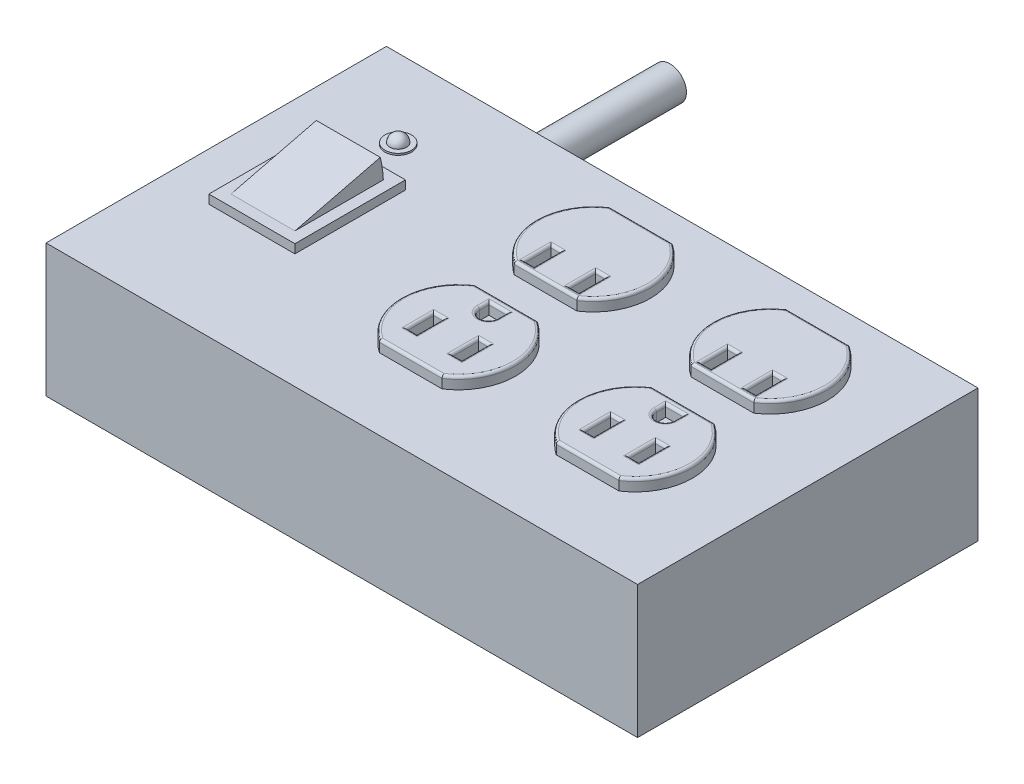
from build123d import *

# Parameters (mm, degrees)
SKETCH1_W               = 169.926
SKETCH1_H               = 97.79
EXTRUDE1_DEPTH          = 38.1
SKETCH2_W               = 24.7142
SKETCH2_H               = 31.75
EXTRUDE2_DEPTH          = 2.54
SKETCH3_W               = 18.3642
SKETCH3_H               = 25.4
CUT_EXTRUDE1_DEPTH      = 2.54
EXTRUDE3_DEPTH          = 18.3642
SKETCH5_R               = 3.81
EXTRUDE4_DEPTH          = 0.508
EXTRUDE6_DEPTH          = 3.3528
SKETCH9_W               = 2.8448
SKETCH9_H               = 7.62
CUT_EXTRUDE2_DEPTH      = 3.3528
FILLET10_R              = 0.762
LPATTERN2_COUNT         = 2
LPATTERN2_PITCH         = 50.8
FILLET10_OF_LPATTERN2_R = 0.762
SKETCH10_R              = 11.1125
EXTRUDE7_DEPTH          = 7.9248
FILLET11_R              = 3.175
SKETCH11_R              = 4.7625
EXTRUDE8_DEPTH          = 42.756866563
CUT_EXTRUDE3_DEPTH      = 1.524
SHELL1_START            = 0.762
SHELL1_OUTLINE_W        = 168.402
SHELL1_OUTLINE_H        = 96.266
SHELL1_DEPTH            = 36.576
SHELL1_START_2          = 1.524
SHELL1_2_OUTLINE_W      = 4.3688
SHELL1_2_OUTLINE_H      = 9.144
SHELL1_2_DEPTH          = 39.1668
SHELL1_3_DEPTH          = 35.814
SHELL1_START_3          = 37.338
SHELL1_4_OUTLINE_W      = 23.1902
SHELL1_4_OUTLINE_H      = 30.226
SHELL1_4_OUTLINE_W_2    = 19.8882
SHELL1_4_OUTLINE_H_2    = 26.924
SHELL1_4_DEPTH          = 2.54
SHELL1_5_OUTLINE_R      = 3.048
SHELL1_5_DEPTH          = 0.508
LPATTERN3_COUNT         = 2
LPATTERN3_PITCH         = 273.05
LPATTERN3_COUNT_DIR2    = 2
LPATTERN3_PITCH_DIR2    = 69.85


with BuildPart() as part:
    # Sketch1 → Extrude1 (new body)
    with BuildSketch(Plane(origin=(0, 0, 0), x_dir=(1, 0, 0), z_dir=(0, 1, 0))):
        Rectangle(SKETCH1_W, SKETCH1_H)
    extrude(amount=EXTRUDE1_DEPTH)

    # Sketch2 → Extrude2 (add)
    with BuildSketch(Plane(origin=(0, 38.1, 0), x_dir=(-1, 0, 0), z_dir=(0, 1, 0))):
        with Locations((58.8391, 0)):
            Rectangle(SKETCH2_W, SKETCH2_H)
    extrude(amount=EXTRUDE2_DEPTH)

    # Sketch3 → Cut-Extrude1 (cut)
    with BuildSketch(Plane(origin=(0, 40.64, 0), x_dir=(-1, 0, 0), z_dir=(0, 1, 0))):
        with Locations((58.8391, 0)):
            Rectangle(SKETCH3_W, SKETCH3_H)
    extrude(amount=-CUT_EXTRUDE1_DEPTH, mode=Mode.SUBTRACT)

    # Sketch5 → Extrude4 (add)
    with BuildSketch(Plane(origin=(0, 38.1, 0), x_dir=(-1, 0, 0), z_dir=(0, 1, 0))):
        with Locations(Location((58.8391, -26.162, 0), (0, 0, 90))):
            Circle(SKETCH5_R)
    extrude(amount=EXTRUDE4_DEPTH)

    # Sketch6 → Revolve2 (revolve)
    with BuildSketch(Plane(origin=(-3.381296693, 0, 5.856577668), x_dir=(-0.8660254037844382, 0, -0.5000000000000009), z_dir=(0.5000000000000009, 0, -0.8660254037844382))):
        with BuildLine():
            Line((64.037155336, 38.608), (64.037155336, 40.9829))
            ThreePointArc((64.037155336, 40.9829), (61.662255336, 38.608), (64.037155336, 36.2331))
            Line((64.037155336, 36.2331), (64.037155336, 38.608))
        make_face()
    revolve(axis=Axis((-58.8391, 38.608, -26.162), (0, -1, 0)))

    # Sketch8 → Extrude6 (add)
    with BuildSketch(Plane(origin=(0, 38.1, 0), x_dir=(-1, 0, 0), z_dir=(0, 1, 0))):
        with BuildLine():
            Line((-59.043938849, 28.321), (-41.032061151, 28.321))
            ThreePointArc((-41.032061151, 28.321), (-33.6296, 14.605), (-41.032061151, 0.889))
            Line((-41.032061151, 0.889), (-59.043938849, 0.889))
            ThreePointArc((-59.043938849, 0.889), (-66.4464, 14.605), (-59.043938849, 28.321))
        make_face()
        with BuildLine():
            Line((-59.043938849, -10.414), (-41.032061151, -10.414))
            ThreePointArc((-41.032061151, -10.414), (-33.6296, -24.13), (-41.032061151, -37.846))
            Line((-41.032061151, -37.846), (-59.043938849, -37.846))
            ThreePointArc((-59.043938849, -37.846), (-66.4464, -24.13), (-59.043938849, -10.414))
        make_face()
    extrude6 = extrude(amount=EXTRUDE6_DEPTH)

    # Sketch9 → Cut-Extrude2 (cut)
    with BuildSketch(Plane(origin=(0, 41.4528, 0), x_dir=(-1, 0, 0), z_dir=(0, 1, 0))):
        with Locations((-56.4896, 17.6784)):
            Rectangle(SKETCH9_W, SKETCH9_H)
        with Locations((-43.5864, 17.6784)):
            Rectangle(SKETCH9_W, SKETCH9_H)
        with BuildLine():
            Line((-52.6415, 3.2766), (-47.4345, 3.2766))
            Line((-47.4345, 3.2766), (-47.4345, 5.9309))
            ThreePointArc((-47.4345, 5.9309), (-50.038, 8.5344), (-52.6415, 5.9309))
            Line((-52.6415, 5.9309), (-52.6415, 3.2766))
        make_face()
        with Locations((-56.4896, -15.9766)):
            Rectangle(SKETCH9_W, SKETCH9_H)
        with Locations((-43.5864, -15.9766)):
            Rectangle(SKETCH9_W, SKETCH9_H)
        with BuildLine():
            Line((-124.841, -30.3784), (-119.634, -30.3784))
            Line((-119.634, -30.3784), (-119.634, -27.7241))
            ThreePointArc((-119.634, -27.7241), (-122.2375, -25.1206), (-124.841, -27.7241))
            Line((-124.841, -27.7241), (-124.841, -30.3784))
        make_face()
    cut_extrude2 = extrude(amount=-CUT_EXTRUDE2_DEPTH, mode=Mode.SUBTRACT)

    # Fillet10
    fillet10_edges = [part.edges().sort_by_distance(p)[0] for p in [
        (57.912, 41.4528, -15.9766),
        (56.4896, 41.4528, -19.7866),
        (55.0672, 41.4528, -15.9766),
        (56.4896, 41.4528, -12.1666),
        (45.0088, 41.4528, -15.9766),
        (43.5864, 41.4528, -19.7866),
        (42.164, 41.4528, -15.9766),
        (43.5864, 41.4528, -12.1666),
        (33.6296, 41.4528, 14.605),
        (50.038, 41.4528, 28.321),
        (66.4464, 41.4528, 14.605),
        (50.038, 41.4528, 0.889),
        (33.6296, 41.4528, -24.13),
        (50.038, 41.4528, -10.414),
        (66.4464, 41.4528, -24.13),
        (50.038, 41.4528, -37.846),
        (57.912, 41.4528, 17.6784),
        (56.4896, 41.4528, 13.8684),
        (55.0672, 41.4528, 17.6784),
        (56.4896, 41.4528, 21.4884),
        (45.0088, 41.4528, 17.6784),
        (43.5864, 41.4528, 13.8684),
        (42.164, 41.4528, 17.6784),
        (43.5864, 41.4528, 21.4884),
        (52.6415, 41.4528, 4.60375),
        (50.038, 41.4528, 3.2766),
        (47.4345, 41.4528, 4.60375),
        (50.038, 41.4528, 8.5344),
    ]]
    fillet(fillet10_edges, radius=FILLET10_R)

    # LPattern2: Extrude6, Cut-Extrude2 ×2
    with Locations(*[(-i * LPATTERN2_PITCH, 0, 0) for i in range(1, LPATTERN2_COUNT)]):
        add(extrude6)
        add(cut_extrude2, mode=Mode.SUBTRACT)

    # Fillet10 of LPattern2
    fillet10_of_lpattern2_edges = [part.edges().sort_by_distance(p)[0] for p in [
        (7.112, 41.4528, -15.9766),
        (5.6896, 41.4528, -19.7866),
        (4.2672, 41.4528, -15.9766),
        (5.6896, 41.4528, -12.1666),
        (-5.7912, 41.4528, -15.9766),
        (-7.2136, 41.4528, -19.7866),
        (-8.636, 41.4528, -15.9766),
        (-7.2136, 41.4528, -12.1666),
        (-17.1704, 41.4528, 14.605),
        (-0.762, 41.4528, 28.321),
        (15.6464, 41.4528, 14.605),
        (-0.762, 41.4528, 0.889),
        (-17.1704, 41.4528, -24.13),
        (-0.762, 41.4528, -10.414),
        (15.6464, 41.4528, -24.13),
        (-0.762, 41.4528, -37.846),
        (7.112, 41.4528, 17.6784),
        (5.6896, 41.4528, 13.8684),
        (4.2672, 41.4528, 17.6784),
        (5.6896, 41.4528, 21.4884),
        (-5.7912, 41.4528, 17.6784),
        (-7.2136, 41.4528, 13.8684),
        (-8.636, 41.4528, 17.6784),
        (-7.2136, 41.4528, 21.4884),
        (1.8415, 41.4528, 4.60375),
        (-0.762, 41.4528, 3.2766),
        (-3.3655, 41.4528, 4.60375),
        (-0.762, 41.4528, 8.5344),
    ]]
    fillet(fillet10_of_lpattern2_edges, radius=FILLET10_OF_LPATTERN2_R)

    # Sketch10 → Extrude7 (add)
    with BuildSketch(Plane(origin=(0, 0, -48.895), x_dir=(-1, 0, 0), z_dir=(0, 0, -1))):
        with Locations(Location((54.229, 19.05, 0), (0, 0, 180))):
            Circle(SKETCH10_R)
    extrude(amount=EXTRUDE7_DEPTH)

    # Fillet11
    fillet11_edges = [part.edges().sort_by_distance(p)[0] for p in [
        (-65.3415, 19.05, -56.8198),
    ]]
    fillet(fillet11_edges, radius=FILLET11_R)

    # Sketch11 → Extrude8 (add)
    with BuildSketch(Plane(origin=(0, 0, -56.8198), x_dir=(-1, 0, 0), z_dir=(0, 0, -1))):
        with Locations((54.229, 19.05)):
            Circle(SKETCH11_R)
    extrude(amount=EXTRUDE8_DEPTH)

    # Sketch12 → Cut-Extrude3 (cut)
    with BuildSketch(Plane.XZ):
        with BuildLine():
            Line((54.707611376, 27.94), (58.238211376, 27.94))
            ThreePointArc((58.238211376, 27.94), (58.981216761, 26.926416761), (59.9948, 26.183411376))
            Line((59.9948, 26.183411376), (59.9948, 22.652811376))
            ThreePointArc((59.9948, 22.652811376), (61.8998, 20.747811376), (63.8048, 22.652811376))
            Line((63.8048, 22.652811376), (63.8048, 26.183411376))
            ThreePointArc((63.8048, 26.183411376), (64.818383239, 26.926416761), (65.561388624, 27.94))
            Line((65.561388624, 27.94), (69.091988624, 27.94))
            ThreePointArc((69.091988624, 27.94), (70.996988624, 29.845), (69.091988624, 31.75))
            Line((69.091988624, 31.75), (65.561388624, 31.75))
            ThreePointArc((65.561388624, 31.75), (64.818383239, 32.763583239), (63.8048, 33.506588624))
            Line((63.8048, 33.506588624), (63.8048, 37.037188624))
            ThreePointArc((63.8048, 37.037188624), (61.8998, 38.942188624), (59.9948, 37.037188624))
            Line((59.9948, 37.037188624), (59.9948, 33.506588624))
            ThreePointArc((59.9948, 33.506588624), (58.981216761, 32.763583239), (58.238211376, 31.75))
            Line((58.238211376, 31.75), (54.707611376, 31.75))
            ThreePointArc((54.707611376, 31.75), (52.802611376, 29.845), (54.707611376, 27.94))
        make_face()
    cut_extrude3 = extrude(amount=-CUT_EXTRUDE3_DEPTH, mode=Mode.SUBTRACT)

    # Shell1: read off the stored shape, not the designer's step
    # Shell1 outline → Shell1 (cut)
    with BuildSketch(Plane(origin=(0, 0, 0), x_dir=(1, 0, 0), z_dir=(0, 1, 0)).offset(SHELL1_START)):
        Rectangle(SHELL1_OUTLINE_W, SHELL1_OUTLINE_H)
        with BuildLine():
            ThreePointArc((54.707611376, -32.512), (52.040611376, -29.845), (54.707611376, -27.178))
            Line((54.707611376, -27.178), (57.801712489, -27.178))
            ThreePointArc((57.801712489, -27.178), (58.442401393, -26.387601393), (59.2328, -25.746912489))
            Line((59.2328, -25.746912489), (59.2328, -22.652811376))
            ThreePointArc((59.2328, -22.652811376), (61.8998, -19.985811376), (64.5668, -22.652811376))
            Line((64.5668, -22.652811376), (64.5668, -25.746912489))
            ThreePointArc((64.5668, -25.746912489), (65.357198607, -26.387601393), (65.997887511, -27.178))
            Line((65.997887511, -27.178), (69.091988624, -27.178))
            ThreePointArc((69.091988624, -27.178), (71.758988624, -29.845), (69.091988624, -32.512))
            Line((69.091988624, -32.512), (65.997887511, -32.512))
            ThreePointArc((65.997887511, -32.512), (65.357198607, -33.302398607), (64.5668, -33.943087511))
            Line((64.5668, -33.943087511), (64.5668, -37.037188624))
            ThreePointArc((64.5668, -37.037188624), (61.8998, -39.704188624), (59.2328, -37.037188624))
            Line((59.2328, -37.037188624), (59.2328, -33.943087511))
            ThreePointArc((59.2328, -33.943087511), (58.442401393, -33.302398607), (57.801712489, -32.512))
            Line((57.801712489, -32.512), (54.707611376, -32.512))
        make_face(mode=Mode.SUBTRACT)
    extrude(amount=SHELL1_DEPTH, mode=Mode.SUBTRACT)

    # Shell1 2 outline → Shell1 2 (cut)
    # profile 1 of 4: a face of its own
    with BuildSketch(Plane(origin=(0, 0, 0), x_dir=(1, 0, 0), z_dir=(0, 1, 0)).offset(SHELL1_START_2)):
        with BuildLine():
            ThreePointArc((41.262823822, -1.651), (34.3916, -14.605), (41.262823822, -27.559))
            Line((41.262823822, -27.559), (58.813176178, -27.559))
            ThreePointArc((58.813176178, -27.559), (65.6844, -14.605), (58.813176178, -1.651))
            Line((58.813176178, -1.651), (41.262823822, -1.651))
        make_face()
        with Locations((43.5864, -17.6784)):
            Rectangle(SHELL1_2_OUTLINE_W, SHELL1_2_OUTLINE_H, mode=Mode.SUBTRACT)
        with Locations((56.4896, -17.6784)):
            Rectangle(SHELL1_2_OUTLINE_W, SHELL1_2_OUTLINE_H, mode=Mode.SUBTRACT)
        with BuildLine():
            Line((53.4035, -2.5146), (53.4035, -5.9309))
            ThreePointArc((53.4035, -5.9309), (50.038, -9.2964), (46.6725, -5.9309))
            Line((46.6725, -5.9309), (46.6725, -2.5146))
            Line((46.6725, -2.5146), (53.4035, -2.5146))
        make_face(mode=Mode.SUBTRACT)
    # profile 2 of 4: a face of its own
    with BuildSketch(Plane(origin=(0, 0, 0), x_dir=(1, 0, 0), z_dir=(0, 1, 0)).offset(SHELL1_START_2)):
        with BuildLine():
            Line((-9.537176178, -27.559), (8.013176178, -27.559))
            ThreePointArc((8.013176178, -27.559), (14.8844, -14.605), (8.013176178, -1.651))
            Line((8.013176178, -1.651), (-9.537176178, -1.651))
            ThreePointArc((-9.537176178, -1.651), (-16.4084, -14.605), (-9.537176178, -27.559))
        make_face()
        with Locations((-7.2136, -17.6784)):
            Rectangle(SHELL1_2_OUTLINE_W, SHELL1_2_OUTLINE_H, mode=Mode.SUBTRACT)
        with BuildLine():
            Line((-4.1275, -2.5146), (2.6035, -2.5146))
            Line((2.6035, -2.5146), (2.6035, -5.9309))
            ThreePointArc((2.6035, -5.9309), (-0.762, -9.2964), (-4.1275, -5.9309))
            Line((-4.1275, -5.9309), (-4.1275, -2.5146))
        make_face(mode=Mode.SUBTRACT)
        with Locations((5.6896, -17.6784)):
            Rectangle(SHELL1_2_OUTLINE_W, SHELL1_2_OUTLINE_H, mode=Mode.SUBTRACT)
    # profile 3 of 4: a face of its own
    with BuildSketch(Plane(origin=(0, 0, 0), x_dir=(1, 0, 0), z_dir=(0, 1, 0)).offset(SHELL1_START_2)):
        with BuildLine():
            ThreePointArc((41.262823822, 37.084), (34.3916, 24.13), (41.262823822, 11.176))
            Line((41.262823822, 11.176), (58.813176178, 11.176))
            ThreePointArc((58.813176178, 11.176), (65.6844, 24.13), (58.813176178, 37.084))
            Line((58.813176178, 37.084), (41.262823822, 37.084))
        make_face()
        with Locations((43.5864, 15.9766)):
            Rectangle(SHELL1_2_OUTLINE_W, SHELL1_2_OUTLINE_H, mode=Mode.SUBTRACT)
        with Locations((56.4896, 15.9766)):
            Rectangle(SHELL1_2_OUTLINE_W, SHELL1_2_OUTLINE_H, mode=Mode.SUBTRACT)
    # profile 4 of 4: a face of its own
    with BuildSketch(Plane(origin=(0, 0, 0), x_dir=(1, 0, 0), z_dir=(0, 1, 0)).offset(SHELL1_START_2)):
        with BuildLine():
            Line((-9.537176178, 11.176), (8.013176178, 11.176))
            ThreePointArc((8.013176178, 11.176), (14.8844, 24.13), (8.013176178, 37.084))
            Line((8.013176178, 37.084), (-9.537176178, 37.084))
            ThreePointArc((-9.537176178, 37.084), (-16.4084, 24.13), (-9.537176178, 11.176))
        make_face()
        with Locations((-7.2136, 15.9766)):
            Rectangle(SHELL1_2_OUTLINE_W, SHELL1_2_OUTLINE_H, mode=Mode.SUBTRACT)
        with Locations((5.6896, 15.9766)):
            Rectangle(SHELL1_2_OUTLINE_W, SHELL1_2_OUTLINE_H, mode=Mode.SUBTRACT)
    extrude(amount=SHELL1_2_DEPTH, mode=Mode.SUBTRACT)

    # Shell1 3 outline → Shell1 3 (cut)
    with BuildSketch(Plane(origin=(0, 0, 0), x_dir=(1, 0, 0), z_dir=(0, 1, 0)).offset(SHELL1_START_2)):
        with BuildLine():
            Line((58.813176178, -27.559), (53.33389634, -27.559))
            ThreePointArc((53.33389634, -27.559), (52.13762587, -30.557785732), (54.707611376, -32.512))
            Line((54.707611376, -32.512), (57.801712489, -32.512))
            ThreePointArc((57.801712489, -32.512), (58.442401393, -33.302398607), (59.2328, -33.943087511))
            Line((59.2328, -33.943087511), (59.2328, -37.037188624))
            ThreePointArc((59.2328, -37.037188624), (61.8998, -39.704188624), (64.5668, -37.037188624))
            Line((64.5668, -37.037188624), (64.5668, -33.943087511))
            ThreePointArc((64.5668, -33.943087511), (65.357198607, -33.302398607), (65.997887511, -32.512))
            Line((65.997887511, -32.512), (69.091988624, -32.512))
            ThreePointArc((69.091988624, -32.512), (71.758988624, -29.845), (69.091988624, -27.178))
            Line((69.091988624, -27.178), (65.997887511, -27.178))
            ThreePointArc((65.997887511, -27.178), (65.357198607, -26.387601393), (64.5668, -25.746912489))
            Line((64.5668, -25.746912489), (64.5668, -22.652811376))
            ThreePointArc((64.5668, -22.652811376), (64.470329554, -21.941990152), (64.187897254, -21.282592431))
            ThreePointArc((64.187897254, -21.282592431), (61.922362455, -24.782021274), (58.813176178, -27.559))
        make_face()
    extrude(amount=SHELL1_3_DEPTH, mode=Mode.SUBTRACT)

    # Shell1 4 outline → Shell1 4 (cut)
    with BuildSketch(Plane(origin=(0, 0, 0), x_dir=(1, 0, 0), z_dir=(0, 1, 0)).offset(SHELL1_START_3)):
        with Locations((-58.8391, 0)):
            Rectangle(SHELL1_4_OUTLINE_W, SHELL1_4_OUTLINE_H)
        with Locations((-58.8391, 0)):
            Rectangle(SHELL1_4_OUTLINE_W_2, SHELL1_4_OUTLINE_H_2, mode=Mode.SUBTRACT)
    extrude(amount=SHELL1_4_DEPTH, mode=Mode.SUBTRACT)

    # Shell1 5 outline → Shell1 5 (cut)
    with BuildSketch(Plane(origin=(0, 0, 0), x_dir=(1, 0, 0), z_dir=(0, 1, 0)).offset(SHELL1_START_3)):
        with Locations((-58.8391, 26.162)):
            Circle(SHELL1_5_OUTLINE_R)
    extrude(amount=SHELL1_5_DEPTH, mode=Mode.SUBTRACT)

    # Shell1 6 outline → Shell1 6 (revolve, cut)
    with BuildSketch(Plane(origin=(-54.229, 19.05, 0), x_dir=(1, 0, 0), z_dir=(0, -1, 0))):
        with BuildLine():
            Line((10.3505, -48.133), (0, -48.133))
            Line((0, -48.133), (0, -98.814666563))
            Line((0, -98.814666563), (4.0005, -98.814666563))
            Line((4.0005, -98.814666563), (4.0005, -56.0578))
            Line((4.0005, -56.0578), (7.9375, -56.0578))
            ThreePointArc((7.9375, -56.0578), (9.643748663, -55.351048663), (10.3505, -53.6448))
            Line((10.3505, -53.6448), (10.3505, -48.133))
        make_face()
    revolve(axis=Axis((-54.229, 19.05, 0), (0, 0, 1)), mode=Mode.SUBTRACT)

    # Shell1 7 outline → Shell1 7 (revolve, cut)
    with BuildSketch(Plane(origin=(-58.8391, 0, -26.162), x_dir=(1, 0, 0), z_dir=(0, 0, 1))):
        with BuildLine():
            Line((0, 40.2209), (0, 37.845999999))
            Line((0, 37.845999999), (1.421549298, 37.845999999))
            ThreePointArc((1.421549298, 37.845999999), (1.383921279, 39.436376909), (0, 40.2209))
        make_face()
    revolve(axis=Axis((-58.8391, 0, -26.162), (0, 1, 0)), mode=Mode.SUBTRACT)

    # LPattern3: Cut-Extrude3 2 × 2
    with Locations(*[(i * LPATTERN3_PITCH, 0, -j * LPATTERN3_PITCH_DIR2) for i in range(LPATTERN3_COUNT) for j in range(LPATTERN3_COUNT_DIR2) if (i, j) != (0, 0)]):
        add(cut_extrude3, mode=Mode.SUBTRACT)


with BuildPart() as body_2:
    # Sketch4 → Extrude3 (new body)
    with BuildSketch(Plane(origin=(-68.0212, 0, 0), x_dir=(0, 0, -1), z_dir=(1, 0, 0))):
        with BuildLine():
            Line((-12.7, 40.64), (11.814357472, 46.6852))
            ThreePointArc((11.814357472, 46.6852), (12.402838556, 43.683939663), (12.7, 40.64))
            Line((12.7, 40.64), (-12.7, 40.64))
        make_face()
    extrude(amount=EXTRUDE3_DEPTH)


solid = Compound([part.part, body_2.part])
